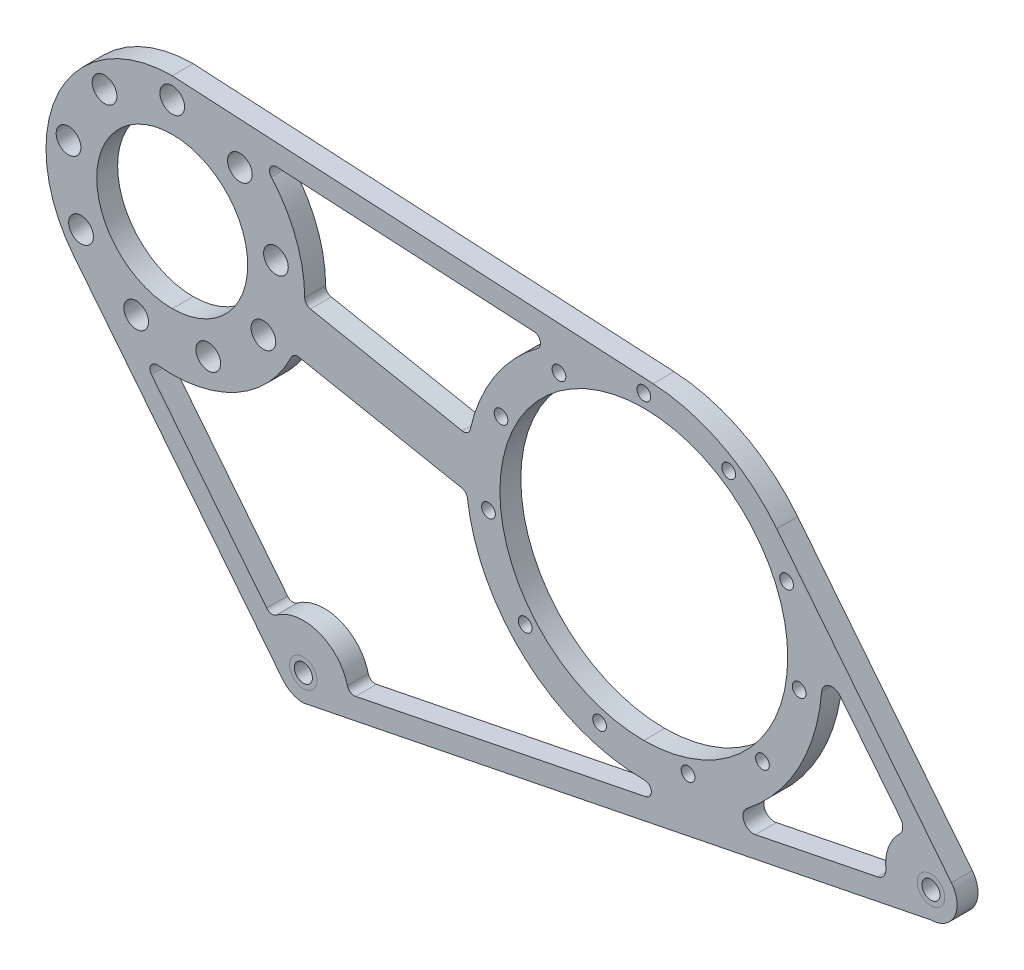
from build123d import *

# Parameters (mm, degrees)
SKETCH1_R               = 3.29946
SKETCH1_R_2             = 27.4955
SKETCH1_R_3             = 52.4256
BOSS_EXTRUDE1_DEPTH     = 7.62
CUT_EXTRUDE1_DEPTH      = 314.319493614
CUT_EXTRUDE1_DEPTH_BACK = 314.319493614
SKETCH2_R               = 4.49961
SKETCH2_R_2             = 2.50063
CUT_EXTRUDE2_DEPTH      = 314.319493614
CUT_EXTRUDE2_DEPTH_BACK = 314.319493614


with BuildPart() as part:
    # Sketch1 → Boss-Extrude1 (new body)
    with BuildSketch(Plane.XY):
        with BuildLine():
            ThreePointArc((40.310707788, -124.394878894), (43.625834707, -127.040890072), (47.760987503, -127.985322704))
            Line((47.760987503, -127.985322704), (276.360987503, -82.143687357))
            ThreePointArc((276.360987503, -82.143687357), (284.941554871, -76.753840153), (283.811267218, -66.684131167))
            Line((283.811267218, -66.684131167), (220.199398147, 13.174615234))
            ThreePointArc((220.199398147, 13.174615234), (200.160512587, 29.620750083), (175.144631834, 36.420602736))
            Line((175.144631834, 36.420602736), (0, 45.974))
            ThreePointArc((0, 45.974), (-41.415538495, 19.959004162), (-35.960016757, -28.644124543))
            Line((-35.960016757, -28.644124543), (40.310707788, -124.394878894))
        make_face()
        with Locations((47.760987503, -118.460322704)):
            Circle(SKETCH1_R, mode=Mode.SUBTRACT)
        with Locations((276.360987503, -72.618687357)):
            Circle(SKETCH1_R, mode=Mode.SUBTRACT)
        Circle(SKETCH1_R_2, mode=Mode.SUBTRACT)
        with Locations((171.77258, -25.4)):
            Circle(SKETCH1_R_3, mode=Mode.SUBTRACT)
    extrude(amount=BOSS_EXTRUDE1_DEPTH)

    # Sketch2 → Cut-Extrude1 (cut, two sides: drawn at the far end of the back side and taken through both)
    with BuildSketch(Plane.XY.offset(7.62).offset(-CUT_EXTRUDE1_DEPTH_BACK)):
        with Locations((0, 38.354)):
            Circle(SKETCH2_R)
        with Locations((171.77258, 31.76905)):
            Circle(SKETCH2_R_2)
        with Locations((24.653475982, 29.380868571)):
            Circle(SKETCH2_R)
        with Locations((37.771316559, 6.660102206)):
            Circle(SKETCH2_R)
        with Locations((33.215538337, -19.177)):
            Circle(SKETCH2_R)
        with Locations((13.117840577, -36.040970778)):
            Circle(SKETCH2_R)
        with Locations((-13.117840577, -36.040970778)):
            Circle(SKETCH2_R)
        with Locations((-33.215538337, -19.177)):
            Circle(SKETCH2_R)
        with Locations((-37.771316559, 6.660102206)):
            Circle(SKETCH2_R)
        with Locations((-24.653475982, 29.380868571)):
            Circle(SKETCH2_R)
        with Locations((202.680501925, 22.693665281)):
            Circle(SKETCH2_R_2)
        with Locations((223.775377024, -1.651118351)):
            Circle(SKETCH2_R_2)
        with Locations((228.359731502, -33.536004105)):
            Circle(SKETCH2_R_2)
        with Locations((214.978065204, -62.837766042)):
            Circle(SKETCH2_R_2)
        with Locations((187.878962629, -80.253301783)):
            Circle(SKETCH2_R_2)
        with Locations((155.666197371, -80.253301783)):
            Circle(SKETCH2_R_2)
        with Locations((128.567094796, -62.837766042)):
            Circle(SKETCH2_R_2)
        with Locations((115.185428498, -33.536004105)):
            Circle(SKETCH2_R_2)
        with Locations((119.769782976, -1.651118351)):
            Circle(SKETCH2_R_2)
        with Locations((140.864658075, 22.693665281)):
            Circle(SKETCH2_R_2)
    extrude(amount=CUT_EXTRUDE1_DEPTH + CUT_EXTRUDE1_DEPTH_BACK, mode=Mode.SUBTRACT)

    # Sketch5 → Cut-Extrude2 (cut, two sides: drawn at the far end of the back side and taken through both)
    with BuildSketch(Plane(origin=(0, 0, 0), x_dir=(-1, 0, 0), z_dir=(0, 0, -1)).offset(-CUT_EXTRUDE2_DEPTH_BACK)):
        with BuildLine():
            Line((-265.24641616, -55.607846582), (-243.309638671, -28.068276122))
            ThreePointArc((-243.309638671, -28.068276122), (-239.219903659, -26.797261631), (-236.532201772, -30.131578483))
            ThreePointArc((-236.532201772, -30.131578483), (-228.218785216, -58.144248242), (-209.343271152, -80.449797567))
            ThreePointArc((-209.343271152, -80.449797567), (-208.220492111, -85.043353427), (-212.433159923, -87.1915662))
            Line((-212.433159923, -87.1915662), (-256.881388734, -78.278270063))
            ThreePointArc((-256.881388734, -78.278270063), (-259.190460551, -76.814996445), (-259.925158693, -74.181899224))
            ThreePointArc((-259.925158693, -74.181899224), (-260.878857786, -66.884251078), (-264.90905738, -60.726109989))
            ThreePointArc((-264.90905738, -60.726109989), (-266.068054891, -58.232252869), (-265.24641616, -55.607846582))
        make_face()
        with BuildLine():
            Line((-131.754965097, 31.155997891), (-38.12708703, 36.26300177))
            ThreePointArc((-38.12708703, 36.26300177), (-35.701196113, 34.830725487), (-36.08930912, 32.040433318))
            ThreePointArc((-36.08930912, 32.040433318), (-45.105625086, 17.161299066), (-48.259972129, 0.05186645))
            ThreePointArc((-48.259972129, 0.05186645), (-48.840291996, -1.561342946), (-50.313400987, -2.438363815))
            Line((-50.313400987, -2.438363815), (-105.593039761, -13.227704597))
            ThreePointArc((-105.593039761, -13.227704597), (-107.469894435, -12.860469717), (-108.558589456, -11.288150386))
            ThreePointArc((-108.558589456, -11.288150386), (-117.439212577, 9.856745234), (-133.131943584, 26.581286223))
            ThreePointArc((-133.131943584, 26.581286223), (-134.048834262, 29.351858), (-131.754965097, 31.155997891))
        make_face()
        with BuildLine():
            Line((-172.497020686, -95.200043594), (-66.759785208, -116.403752218))
            ThreePointArc((-66.759785208, -116.403752218), (-64.898408853, -116.057311266), (-63.793790983, -114.519597825))
            ThreePointArc((-63.793790983, -114.519597825), (-53.348385706, -102.924522715), (-37.910600393, -105.210795401))
            ThreePointArc((-37.910600393, -105.210795401), (-36.067318036, -105.691160666), (-34.408414964, -104.754954902))
            Line((-34.408414964, -104.754954902), (7.552696475, -52.076707806))
            ThreePointArc((7.552696475, -52.076707806), (7.7901592, -49.267572092), (5.287657457, -47.969451515))
            ThreePointArc((5.287657457, -47.969451515), (-23.30510003, -42.259909046), (-43.390999871, -21.124600118))
            ThreePointArc((-43.390999871, -21.124600118), (-44.541450027, -19.963260096), (-46.161306381, -19.743461099))
            Line((-46.161306381, -19.743461099), (-105.477050266, -31.320558719))
            ThreePointArc((-105.477050266, -31.320558719), (-106.846053421, -32.079030552), (-107.510559814, -33.496027522))
            ThreePointArc((-107.510559814, -33.496027522), (-129.012430096, -74.048972037), (-171.989119852, -90.16963803))
            ThreePointArc((-171.989119852, -90.16963803), (-174.524763167, -92.454466996), (-172.497020686, -95.200043594))
        make_face()
    extrude(amount=CUT_EXTRUDE2_DEPTH + CUT_EXTRUDE2_DEPTH_BACK, mode=Mode.SUBTRACT)


solid = part.part
